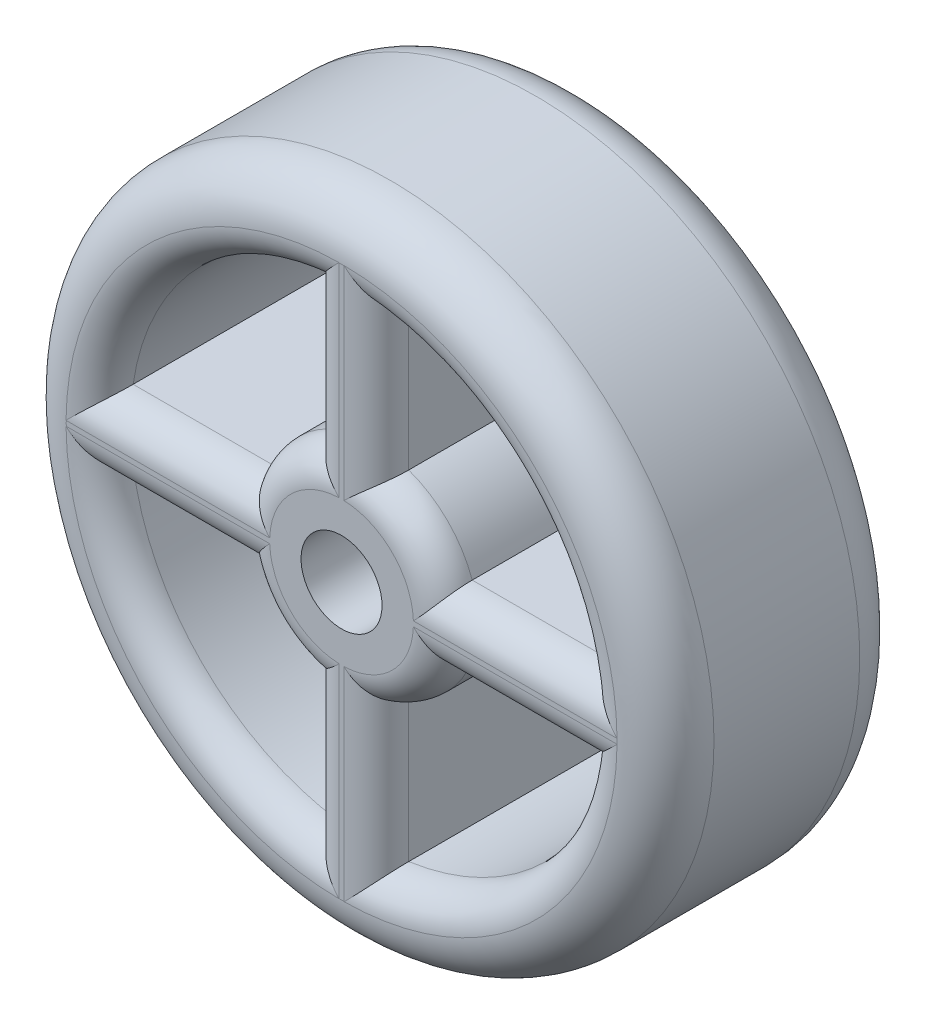
from build123d import *

# Parameters (mm, degrees)
SKETCH2_R           = 20
SKETCH2_R_2         = 2.5
BOSS_EXTRUDE1_DEPTH = 15
SKETCH3_R           = 2.41667892
BOSS_EXTRUDE2_DEPTH = 15
FILLET2_R           = 2
FILLET3_R           = 3
SKETCH4_R           = 2.46809762
CUT_EXTRUDE1_DEPTH  = 7.5


with BuildPart() as part:
    # Sketch2 → Boss-Extrude1 (new body)
    with BuildSketch(Plane.XY):
        Circle(SKETCH2_R)
        Circle(SKETCH2_R_2, mode=Mode.SUBTRACT)
        with BuildLine():
            Line((-2.146310324, 6.070682338), (-2.146310324, 14.870074118))
            ThreePointArc((-2.146310324, 14.870074118), (-10.623694091, 10.623694091), (-14.870074118, 2.146310324))
            Line((-14.870074118, 2.146310324), (-6.070682338, 2.146310324))
            ThreePointArc((-6.070682338, 2.146310324), (-4.553011753, 4.553011753), (-2.146310324, 6.070682338))
        make_face(mode=Mode.SUBTRACT)
        with BuildLine():
            Line((2.146310324, 6.070682338), (2.146310324, 14.870074118))
            ThreePointArc((2.146310324, 14.870074118), (10.623694091, 10.623694091), (14.870074118, 2.146310324))
            Line((14.870074118, 2.146310324), (6.070682338, 2.146310324))
            ThreePointArc((6.070682338, 2.146310324), (4.553011753, 4.553011753), (2.146310324, 6.070682338))
        make_face(mode=Mode.SUBTRACT)
        with BuildLine():
            Line((6.064732431, -2.163065556), (14.867646071, -2.163065556))
            ThreePointArc((14.867646071, -2.163065556), (10.617706659, -10.629678151), (2.146310324, -14.870074118))
            Line((2.146310324, -14.870074118), (2.146310324, -6.070682338))
            ThreePointArc((2.146310324, -6.070682338), (4.546721127, -4.5592937), (6.064732431, -2.163065556))
        make_face(mode=Mode.SUBTRACT)
        with BuildLine():
            Line((-2.146310324, -6.070682338), (-2.146310324, -14.870074118))
            ThreePointArc((-2.146310324, -14.870074118), (-10.617706659, -10.629678151), (-14.867646071, -2.163065556))
            Line((-14.867646071, -2.163065556), (-6.064732431, -2.163065556))
            ThreePointArc((-6.064732431, -2.163065556), (-4.546721127, -4.5592937), (-2.146310324, -6.070682338))
        make_face(mode=Mode.SUBTRACT)
    extrude(amount=BOSS_EXTRUDE1_DEPTH)

    # Fillet2
    fillet2_edges = [part.edges().sort_by_distance(p)[0] for p in [
        (10.470378228, 2.146310324, 15),
        (-10.470378228, 2.146310324, 15),
        (-10.623694091, 10.623694091, 15),
        (-2.146310324, 10.470378228, 15),
        (4.553011753, 4.553011753, 15),
        (2.146310324, 10.470378228, 15),
        (10.623694091, 10.623694091, 15),
        (2.146310324, -10.470378228, 15),
        (4.546721127, -4.5592937, 15),
        (10.466189251, -2.163065556, 15),
        (10.617706659, -10.629678151, 15),
        (-10.466189251, -2.163065556, 15),
        (-4.546721127, -4.5592937, 15),
        (-2.146310324, -10.470378228, 15),
        (-10.617706659, -10.629678151, 15),
        (-4.553011753, 4.553011753, 15),
    ]]
    fillet(fillet2_edges, radius=FILLET2_R)

    # Fillet3
    # the kernel refuses this fillet: 3 mm, written as the material it takes off along each edge
    with BuildSketch(Plane(origin=(0, 0, 15), x_dir=(1, 0, 0), z_dir=(0, -1, 0))) as fillet3_piece_1:
        with BuildLine():
            CenterArc((20 - FILLET3_R, -FILLET3_R), FILLET3_R, 0, 90)
            Line((20, -FILLET3_R), (20 + FILLET3_R * 0.02, -FILLET3_R))
            Line((20 + FILLET3_R * 0.02, -FILLET3_R), (20 + FILLET3_R * 0.02, FILLET3_R * 0.02))
            Line((20 + FILLET3_R * 0.02, FILLET3_R * 0.02), (20 - FILLET3_R, FILLET3_R * 0.02))
            Line((20 - FILLET3_R, FILLET3_R * 0.02), (20 - FILLET3_R, 0))
        make_face()
    revolve(axis=Axis((0, 0, 15), (0, 0, 1)), mode=Mode.SUBTRACT)
    with BuildSketch(Plane(origin=(0, 0, 0), x_dir=(1, 0, 0), z_dir=(0, -1, 0))) as fillet3_piece_2:
        with BuildLine():
            CenterArc((20 - FILLET3_R, FILLET3_R), FILLET3_R, 270, 90)
            Line((20, FILLET3_R), (20 + FILLET3_R * 0.02, FILLET3_R))
            Line((20 + FILLET3_R * 0.02, FILLET3_R), (20 + FILLET3_R * 0.02, -FILLET3_R * 0.02))
            Line((20 + FILLET3_R * 0.02, -FILLET3_R * 0.02), (20 - FILLET3_R, -FILLET3_R * 0.02))
            Line((20 - FILLET3_R, -FILLET3_R * 0.02), (20 - FILLET3_R, 0))
        make_face()
    revolve(axis=Axis((0, 0, 0), (0, 0, 1)), mode=Mode.SUBTRACT)


with BuildPart() as body_2:
    # Sketch3 → Boss-Extrude2 (new body)
    with BuildSketch(Plane.XY.offset(15)):
        Circle(SKETCH3_R)
    extrude(amount=-BOSS_EXTRUDE2_DEPTH)

    # Sketch4 → Cut-Extrude1 (cut)
    with BuildSketch(Plane.XY.offset(15)):
        Circle(SKETCH4_R)
    extrude(amount=-CUT_EXTRUDE1_DEPTH, mode=Mode.SUBTRACT)


solid = Compound([part.part, body_2.part])
